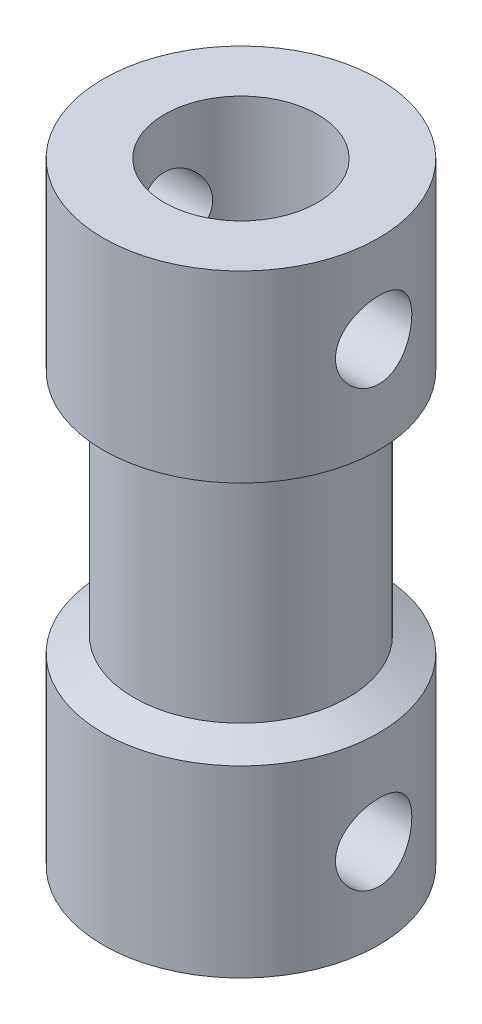
from build123d import *

# Parameters (mm, degrees)
SKETCH_1_R         = 4.5
SKETCH_1_R_2       = 2.5
EXTRUDE_1_DEPTH    = 6.5
SKETCH_2_R         = 3.5
EXTRUDE_2_DEPTH    = 7
SKETCH_3_R         = 4.5
SKETCH_3_R_2       = 2.5
EXTRUDE_3_DEPTH    = 6.5
CHAMFER_1_SIZE2    = 1
CHAMFER_1_SIZE     = 0.5
CHAMFER_2_SIZE2    = 0.5
CHAMFER_2_SIZE     = 1
HOLE_WIZARD_M3_1_D = 2.5
HOLE_WIZARD_M3_2_D = 2.5


with BuildPart() as part:
    # 草图1 → 凸台-拉伸1 (new body)
    with BuildSketch(Plane(origin=(0, 0, 0), x_dir=(1, 0, 0), z_dir=(0, 1, 0))):
        with Locations(Location((0, 0, 0), (0, 0, 90))):
            Circle(SKETCH_1_R)
        with Locations(Location((0, 0, 0), (0, 0, 90))):
            Circle(SKETCH_1_R_2, mode=Mode.SUBTRACT)
    extrude(amount=EXTRUDE_1_DEPTH)

    # 草图2 → 凸台-拉伸2 (add)
    with BuildSketch(Plane(origin=(0, 6.5, 0), x_dir=(1, 0, 0), z_dir=(0, 1, 0))):
        with Locations(Location((0, 0, 0), (0, 0, 270))):
            Circle(SKETCH_2_R)
    extrude(amount=EXTRUDE_2_DEPTH)

    # 草图3 → 凸台-拉伸3 (add)
    with BuildSketch(Plane(origin=(0, 13.5, 0), x_dir=(1, 0, 0), z_dir=(0, 1, 0))):
        with Locations(Location((0, 0, 0), (0, 0, 90))):
            Circle(SKETCH_3_R)
        with Locations(Location((0, 0, 0), (0, 0, 90))):
            Circle(SKETCH_3_R_2, mode=Mode.SUBTRACT)
    extrude(amount=EXTRUDE_3_DEPTH)

    # 倒角1
    chamfer_1_edges = [part.edges().sort_by_distance(p)[0] for p in [
        (0, 6.5, 4.5),
    ]]
    chamfer_1_side = [part.faces().sort_by_distance(p)[0] for p in [
        (0, 6.49, 4.5),
    ]]
    chamfer(chamfer_1_edges, length=CHAMFER_1_SIZE - 0.0001, length2=CHAMFER_1_SIZE2 - 0.0001, reference=chamfer_1_side[0])  # a hair under: the kernel refuses the full size

    # 倒角2
    chamfer_2_edges = [part.edges().sort_by_distance(p)[0] for p in [
        (0, 13.5, 4.5),
    ]]
    chamfer_2_side = [part.faces().sort_by_distance(p)[0] for p in [
        (0, 13.5, 4.49),
    ]]
    chamfer(chamfer_2_edges, length=CHAMFER_2_SIZE - 0.0001, length2=CHAMFER_2_SIZE2 - 0.0001, reference=chamfer_2_side[0])  # a hair under: the kernel refuses the full size

    # M3 螺纹孔1 (through all)
    with Locations(Plane(origin=(4.499987687, 2.904707671, -0.01052714), x_dir=(0.002339364434, 0, 0.999997263683), z_dir=(0.999997263683, 0, -0.002339364434))):
        with Locations((0, 0)):
            Hole(HOLE_WIZARD_M3_1_D / 2)

    # M3 螺纹孔2 (through all)
    with Locations(Plane(origin=(4.499987687, 17.116346609, -0.01052714), x_dir=(0.002339364434, 0, 0.999997263683), z_dir=(0.999997263683, 0, -0.002339364434))):
        with Locations((0, 0)):
            Hole(HOLE_WIZARD_M3_2_D / 2)


solid = part.part
